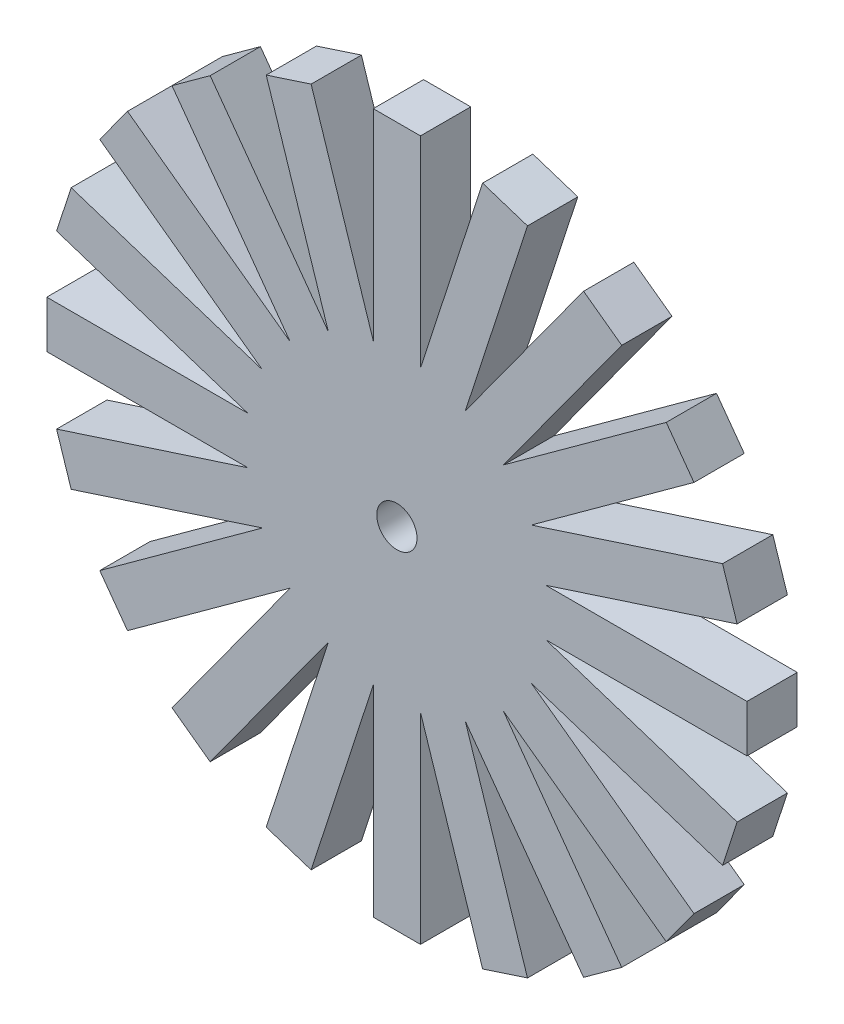
from build123d import *

# Parameters (mm, degrees)
ESQUISSE1_R        = 2
BOSS_EXTRU_1_DEPTH = 5


with BuildPart() as part:
    # Esquisse1 → Boss.-Extru.1 (new body)
    with BuildSketch(Plane.XY):
        Polygon((-32.386228189, -12.990197384), (-13.365097863, -6.809857496), (-29.54543775, -18.565562542), (-26.786941605, -22.362306764), (-10.606601718, -10.606601718), (-22.362306764, -26.786941605), (-18.565562542, -29.54543775), (-6.809857496, -13.365097863), (-12.990197384, -32.386228189), (-8.526856863, -33.836455435), (-2.346516976, -14.815325109), (-2.346516976, -34.815325109), (2.346516976, -34.815325109), (2.346516976, -14.815325109), (8.526856863, -33.836455435), (12.990197384, -32.386228189), (6.809857496, -13.365097863), (18.565562542, -29.54543775), (22.362306764, -26.786941605), (10.606601718, -10.606601718), (26.786941605, -22.362306764), (29.54543775, -18.565562542), (13.365097863, -6.809857496), (32.386228189, -12.990197384), (33.836455435, -8.526856863), (14.815325109, -2.346516976), (34.815325109, -2.346516976), (34.815325109, 2.346516976), (14.815325109, 2.346516976), (33.836455435, 8.526856863), (32.386228189, 12.990197384), (13.365097863, 6.809857496), (29.54543775, 18.565562542), (26.786941605, 22.362306764), (10.606601718, 10.606601718), (22.362306764, 26.786941605), (18.565562542, 29.54543775), (6.809857496, 13.365097863), (12.990197384, 32.386228189), (8.526856863, 33.836455435), (2.346516976, 14.815325109), (2.346516976, 34.815325109), (-2.346516976, 34.815325109), (-2.346516976, 14.815325109), (-8.526856863, 33.836455435), (-12.990197384, 32.386228189), (-6.809857496, 13.365097863), (-18.565562542, 29.54543775), (-22.362306764, 26.786941605), (-10.606601718, 10.606601718), (-26.786941605, 22.362306764), (-29.54543775, 18.565562542), (-13.365097863, 6.809857496), (-32.386228189, 12.990197384), (-33.836455435, 8.526856863), (-14.815325109, 2.346516976), (-34.815325109, 2.346516976), (-34.815325109, -2.346516976), (-14.815325109, -2.346516976), (-33.836455435, -8.526856863), align=None)
        Circle(ESQUISSE1_R, mode=Mode.SUBTRACT)
    extrude(amount=BOSS_EXTRU_1_DEPTH)


solid = part.part
